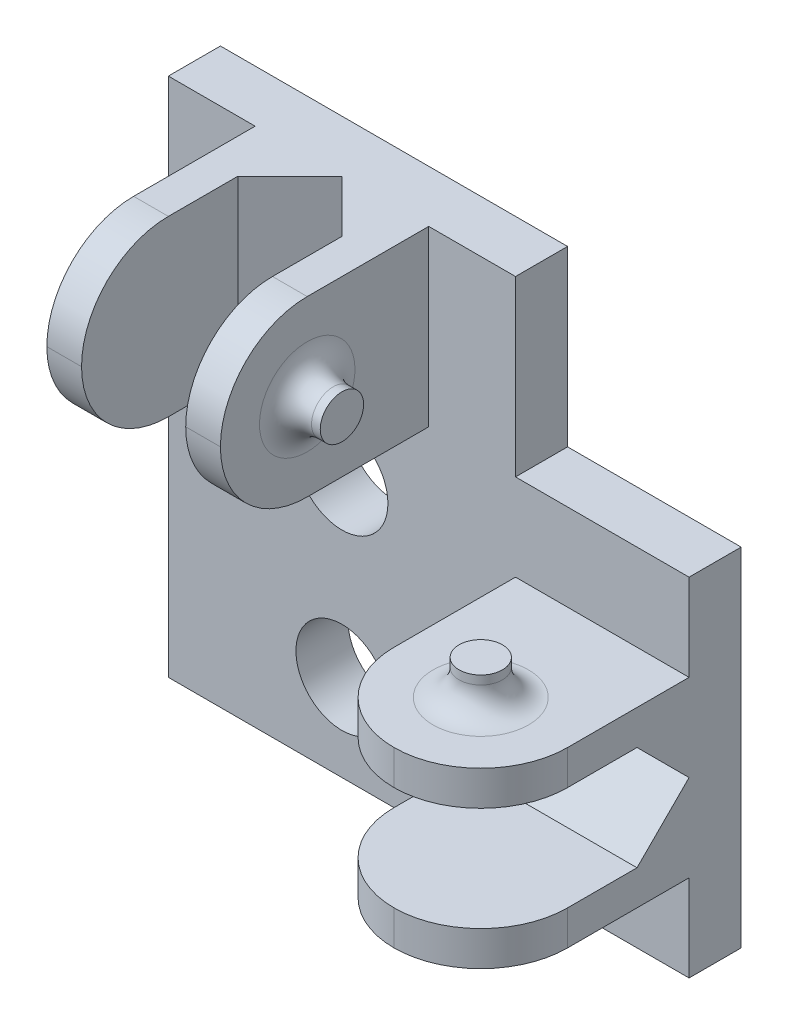
from build123d import *

# Parameters (mm, degrees)
SKETCH1_W           = 20
SKETCH1_H           = 30
SKETCH1_R           = 2.65
SKETCH1_W_2         = 10
SKETCH1_H_2         = 20
BOSS_EXTRUDE1_DEPTH = 3
SKETCH2_W           = 10
SKETCH2_H           = 2
SKETCH2_W_2         = 2
SKETCH2_H_2         = 10
BOSS_EXTRUDE2_DEPTH = 12
FILLET1_R           = 5
SKETCH3_R           = 1.25
BOSS_EXTRUDE3_DEPTH = 2
BOSS_EXTRUDE4_START = -12
SKETCH3_2_R         = 1.25
BOSS_EXTRUDE4_DEPTH = 2
SKETCH4_R           = 1.25
BOSS_EXTRUDE5_DEPTH = 2
BOSS_EXTRUDE6_START = -12
SKETCH4_3_R         = 1.25
BOSS_EXTRUDE6_DEPTH = 2
FILLET2_R           = 1.5
CHAMFER1_SIZE       = 3


with BuildPart() as part:
    # Sketch1 → Boss-Extrude1 (new body)
    # profile 1 of 2: a face of its own
    with BuildSketch(Plane.XY):
        Rectangle(SKETCH1_W, SKETCH1_H)
        Circle(SKETCH1_R, mode=Mode.SUBTRACT)
        with Locations((0, -10)):
            Circle(SKETCH1_R, mode=Mode.SUBTRACT)
    # profile 2 of 2: a face of its own
    with BuildSketch(Plane.XY):
        with Locations((15, -5)):
            Rectangle(SKETCH1_W_2, SKETCH1_H_2)
    extrude(amount=BOSS_EXTRUDE1_DEPTH)

    # Sketch2 → Boss-Extrude2 (add)
    with BuildSketch(Plane.XY.offset(3)):
        with Locations((15, -9)):
            Rectangle(SKETCH2_W, SKETCH2_H)
        with Locations((15, -1)):
            Rectangle(SKETCH2_W, SKETCH2_H)
        with Locations((4, 10)):
            Rectangle(SKETCH2_W_2, SKETCH2_H_2)
        with Locations((-4, 10)):
            Rectangle(SKETCH2_W_2, SKETCH2_H_2)
    extrude(amount=BOSS_EXTRUDE2_DEPTH)

    # Fillet1
    fillet1_edges = [part.edges().sort_by_distance(p)[0] for p in [
        (-4, 15, 15),
        (-4, 5, 15),
        (4, 15, 15),
        (4, 5, 15),
        (10, -1, 15),
        (20, -1, 15),
        (20, -9, 15),
        (10, -9, 15),
    ]]
    fillet(fillet1_edges, radius=FILLET1_R - 0.0001)  # a hair under: the kernel refuses the full size

    # Sketch3 → Boss-Extrude3 (add)
    with BuildSketch(Plane.XZ.offset(10)):
        with Locations(Location((15, 10, 0), (0, 0, 180))):
            Circle(SKETCH3_R)
    extrude(amount=BOSS_EXTRUDE3_DEPTH)

    # Sketch3<2> → Boss-Extrude4 (add)
    with BuildSketch(Plane.XZ.offset(10).offset(BOSS_EXTRUDE4_START)):
        with Locations(Location((15, 10, 0), (0, 0, 180))):
            Circle(SKETCH3_2_R)
    extrude(amount=BOSS_EXTRUDE4_DEPTH)

    # Sketch4 → Boss-Extrude5 (add)
    with BuildSketch(Plane(origin=(5, 0, 0), x_dir=(0, 0, -1), z_dir=(1, 0, 0))):
        with Locations(Location((-10, 10, 0), (0, 0, 270))):
            Circle(SKETCH4_R)
    extrude(amount=BOSS_EXTRUDE5_DEPTH)

    # Sketch4<3> → Boss-Extrude6 (add)
    with BuildSketch(Plane(origin=(5, 0, 0), x_dir=(0, 0, -1), z_dir=(1, 0, 0)).offset(BOSS_EXTRUDE6_START)):
        with Locations(Location((-10, 10, 0), (0, 0, 270))):
            Circle(SKETCH4_3_R)
    extrude(amount=BOSS_EXTRUDE6_DEPTH)

    # Fillet2
    fillet2_edges = [part.edges().sort_by_distance(p)[0] for p in [
        (16.25, -10, 10),
        (16.25, 0, 10),
        (5, 11.25, 10),
        (-5, 11.25, 10),
    ]]
    fillet(fillet2_edges, radius=FILLET2_R)

    # Chamfer1
    chamfer1_edges = [part.edges().sort_by_distance(p)[0] for p in [
        (15, -8, 3),
        (15, -2, 3),
        (-3, 10, 3),
        (3, 10, 3),
    ]]
    chamfer(chamfer1_edges, length=CHAMFER1_SIZE - 0.0001)  # a hair under: the kernel refuses the full size


solid = part.part
